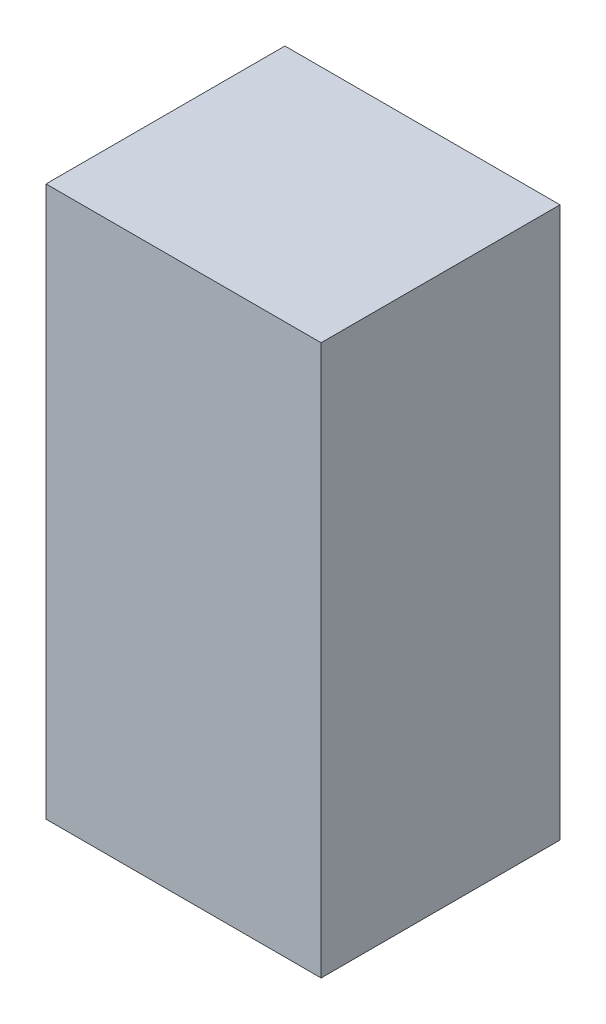
from build123d import *

# Parameters (mm, degrees)
SKETCH1_W           = 38
SKETCH1_H           = 33
BOSS_EXTRUDE1_DEPTH = 76


with BuildPart() as part:
    # Sketch1 → Boss-Extrude1 (new body)
    with BuildSketch(Plane(origin=(0, 0, 0), x_dir=(1, 0, 0), z_dir=(0, 1, 0))):
        Rectangle(SKETCH1_W, SKETCH1_H)
    extrude(amount=BOSS_EXTRUDE1_DEPTH)


solid = part.part
